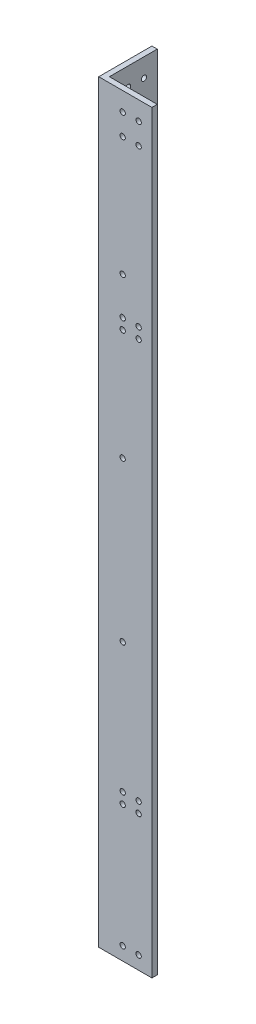
from build123d import *

# Parameters (mm, degrees)
BOSS_EXTRUDE1_DEPTH               = 450
BACKSIDEHOLES_SKETCH3_R           = 1.5875
BACKSIDEHOLES_CUT_EXTRUDE1_DEPTH  = 3.175
RIGHTSIDEHOLES_SKETCH4_R          = 1.5875
RIGHTSIDEHOLES_CUT_EXTRUDE2_DEPTH = 3.175


with BuildPart() as part:
    # Sketch2 → Boss-Extrude1 (new body)
    with BuildSketch(Plane(origin=(0, 0, 0), x_dir=(1, 0, 0), z_dir=(0, 1, 0))):
        Polygon((0, 31.75), (3.175, 31.75), (3.175, 3.175), (31.75, 3.175), (31.75, 0), (0, 0), align=None)
    extrude(amount=BOSS_EXTRUDE1_DEPTH)

    # BackSideHoles-Sketch3 → BackSideHoles-Cut-Extrude1 (cut)
    with BuildSketch(Plane.XY):
        with Locations((14.2875, 81.1125)):
            Circle(BACKSIDEHOLES_SKETCH3_R)
        with Locations((23.8125, 81.1125)):
            Circle(BACKSIDEHOLES_SKETCH3_R)
        with Locations((14.2875, 87.4625)):
            Circle(BACKSIDEHOLES_SKETCH3_R)
        with Locations((23.8125, 87.4625)):
            Circle(BACKSIDEHOLES_SKETCH3_R)
        with Locations((14.2875, 438.8875)):
            Circle(BACKSIDEHOLES_SKETCH3_R)
        with Locations((14.2875, 426.1875)):
            Circle(BACKSIDEHOLES_SKETCH3_R)
        with Locations((23.8125, 438.8875)):
            Circle(BACKSIDEHOLES_SKETCH3_R)
        with Locations((23.8125, 426.1875)):
            Circle(BACKSIDEHOLES_SKETCH3_R)
        with Locations((14.2875, 332.602644)):
            Circle(BACKSIDEHOLES_SKETCH3_R)
        with Locations((23.8125, 332.602644)):
            Circle(BACKSIDEHOLES_SKETCH3_R)
        with Locations((14.2875, 326.252644)):
            Circle(BACKSIDEHOLES_SKETCH3_R)
        with Locations((23.8125, 326.252644)):
            Circle(BACKSIDEHOLES_SKETCH3_R)
        with Locations((14.2875, 165)):
            Circle(BACKSIDEHOLES_SKETCH3_R)
        with Locations((14.2875, 260)):
            Circle(BACKSIDEHOLES_SKETCH3_R)
        with Locations((14.2875, 355)):
            Circle(BACKSIDEHOLES_SKETCH3_R)
        with Locations((14.2875, 7.9375)):
            Circle(BACKSIDEHOLES_SKETCH3_R)
        with Locations((23.8125, 7.9375)):
            Circle(BACKSIDEHOLES_SKETCH3_R)
    extrude(amount=-BACKSIDEHOLES_CUT_EXTRUDE1_DEPTH, mode=Mode.SUBTRACT)

    # RightSideHoles-Sketch4 → RightSideHoles-Cut-Extrude2 (cut)
    with BuildSketch(Plane.ZY):
        with Locations((-23.8125, 81.1125)):
            Circle(RIGHTSIDEHOLES_SKETCH4_R)
        with Locations((-14.2875, 81.1125)):
            Circle(RIGHTSIDEHOLES_SKETCH4_R)
        with Locations((-23.8125, 87.4625)):
            Circle(RIGHTSIDEHOLES_SKETCH4_R)
        with Locations((-14.2875, 87.4625)):
            Circle(RIGHTSIDEHOLES_SKETCH4_R)
        with Locations((-23.8125, 438.8875)):
            Circle(RIGHTSIDEHOLES_SKETCH4_R)
        with Locations((-14.2875, 438.8875)):
            Circle(RIGHTSIDEHOLES_SKETCH4_R)
        with Locations((-23.8125, 426.1875)):
            Circle(RIGHTSIDEHOLES_SKETCH4_R)
        with Locations((-14.2875, 426.1875)):
            Circle(RIGHTSIDEHOLES_SKETCH4_R)
        with Locations((-23.8125, 332.602644)):
            Circle(RIGHTSIDEHOLES_SKETCH4_R)
        with Locations((-14.2875, 332.602644)):
            Circle(RIGHTSIDEHOLES_SKETCH4_R)
        with Locations((-23.8125, 319.902644)):
            Circle(RIGHTSIDEHOLES_SKETCH4_R)
        with Locations((-14.2875, 319.902644)):
            Circle(RIGHTSIDEHOLES_SKETCH4_R)
        with Locations((-23.8125, 7.9375)):
            Circle(RIGHTSIDEHOLES_SKETCH4_R)
        with Locations((-14.2875, 7.9375)):
            Circle(RIGHTSIDEHOLES_SKETCH4_R)
        with Locations((-14.2875, 165)):
            Circle(RIGHTSIDEHOLES_SKETCH4_R)
        with Locations((-14.2875, 260)):
            Circle(RIGHTSIDEHOLES_SKETCH4_R)
        with Locations((-14.2875, 355)):
            Circle(RIGHTSIDEHOLES_SKETCH4_R)
    extrude(amount=-RIGHTSIDEHOLES_CUT_EXTRUDE2_DEPTH, mode=Mode.SUBTRACT)


solid = part.part
